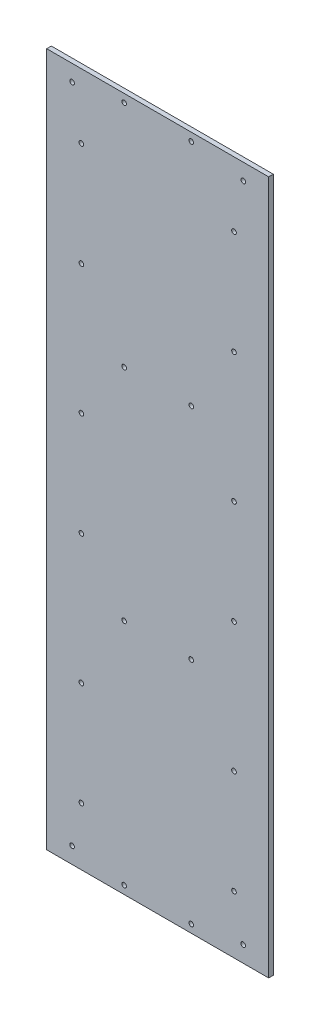
from build123d import *

# Parameters (mm, degrees)
SKETCH1_W           = 96
SKETCH1_H           = 300
BOSS_EXTRUDE1_DEPTH = 2
SKETCH2_R           = 1
CUT_EXTRUDE1_DEPTH  = 10
SKETCH3_R           = 1
CUT_EXTRUDE2_DEPTH  = 10


with BuildPart() as part:
    # Sketch1 → Boss-Extrude1 (new body)
    with BuildSketch(Plane.XY):
        Rectangle(SKETCH1_W, SKETCH1_H)
    extrude(amount=BOSS_EXTRUDE1_DEPTH)

    # Sketch2 → Cut-Extrude1 (cut)
    with BuildSketch(Plane.XY.offset(2)):
        with Locations((-33, 122)):
            Circle(SKETCH2_R)
        with Locations((-33, 77)):
            Circle(SKETCH2_R)
        with Locations((-33, -125)):
            Circle(SKETCH2_R)
        with Locations((14.5, -146.5)):
            Circle(SKETCH2_R)
        with Locations((-14.5, -146.5)):
            Circle(SKETCH2_R)
        with Locations((-14.5, -47.5)):
            Circle(SKETCH2_R)
        with Locations((-14.5, 47.5)):
            Circle(SKETCH2_R)
        with Locations((-14.5, 146.5)):
            Circle(SKETCH2_R)
        with Locations((14.5, 146.5)):
            Circle(SKETCH2_R)
        with Locations((-33, -80)):
            Circle(SKETCH2_R)
        with Locations((-33, -24)):
            Circle(SKETCH2_R)
        with Locations((-33, 21)):
            Circle(SKETCH2_R)
        with Locations((33, 21)):
            Circle(SKETCH2_R)
        with Locations((33, -24)):
            Circle(SKETCH2_R)
        with Locations((33, -80)):
            Circle(SKETCH2_R)
        with Locations((33, -125)):
            Circle(SKETCH2_R)
        with Locations((33, 77)):
            Circle(SKETCH2_R)
        with Locations((33, 122)):
            Circle(SKETCH2_R)
        with Locations((14.5, -47.5)):
            Circle(SKETCH2_R)
        with Locations((14.5, 47.5)):
            Circle(SKETCH2_R)
    extrude(amount=-CUT_EXTRUDE1_DEPTH, mode=Mode.SUBTRACT)

    # Sketch3 → Cut-Extrude2 (cut)
    with BuildSketch(Plane.XY.offset(2)):
        with Locations((-37, 143)):
            Circle(SKETCH3_R)
        with Locations((37, 143)):
            Circle(SKETCH3_R)
        with Locations((-37, -143)):
            Circle(SKETCH3_R)
        with Locations((37, -143)):
            Circle(SKETCH3_R)
    extrude(amount=-CUT_EXTRUDE2_DEPTH, mode=Mode.SUBTRACT)


solid = part.part
